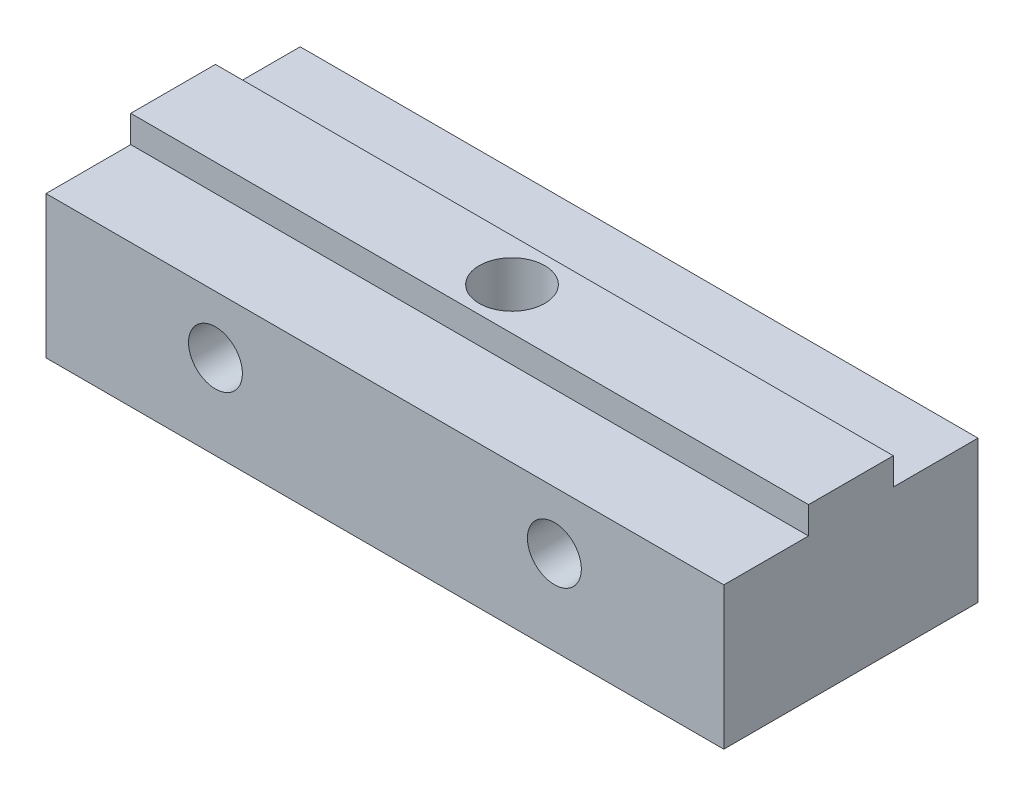
from build123d import *

# Parameters (mm, degrees)
SKETCH1_W                    = 50.8
SKETCH1_H                    = 19.05
BOSS_EXTRUDE1_DEPTH          = 12.7
F_10_32_TAPPED_HOLE1_D       = 4.0386
F_10_0_1935_DIAMETER_HOLE1_D = 4.9149
SKETCH2_OUTSIDE_W            = 63.944
SKETCH2_OUTSIDE_H            = 32.194
SKETCH2_OUTSIDE_W_2          = 50.8
SKETCH2_OUTSIDE_H_2          = 6.35
CUT_EXTRUDE1_DEPTH           = 2.032


with BuildPart() as part:
    # Sketch1 → Boss-Extrude1 (new body)
    with BuildSketch(Plane(origin=(0, 0, 0), x_dir=(1, 0, 0), z_dir=(0, 1, 0))):
        Rectangle(SKETCH1_W, SKETCH1_H)
    extrude(amount=BOSS_EXTRUDE1_DEPTH)

    # #10-32 Tapped Hole1 (through all)
    with Locations(Plane(origin=(0, 0, -9.525), x_dir=(-1, 0, 0), z_dir=(0, 0, -1))):
        with Locations((12.7, 6.35), (-12.7, 6.35)):
            Hole(F_10_32_TAPPED_HOLE1_D / 2)

    # #10 (0.1935) Diameter Hole1 (through all)
    with Locations(Plane(origin=(0, 0, 0), x_dir=(-1, 0, 0), z_dir=(0, -1, 0))):
        with Locations((0, 0)):
            Hole(F_10_0_1935_DIAMETER_HOLE1_D / 2)

    # Sketch2 outside → Cut-Extrude1 (cut)
    with BuildSketch(Plane(origin=(0, 12.7, 0), x_dir=(1, 0, 0), z_dir=(0, 1, 0))):
        Rectangle(SKETCH2_OUTSIDE_W, SKETCH2_OUTSIDE_H)
        Rectangle(SKETCH2_OUTSIDE_W_2, SKETCH2_OUTSIDE_H_2, mode=Mode.SUBTRACT)
    extrude(amount=-CUT_EXTRUDE1_DEPTH, mode=Mode.SUBTRACT)


solid = part.part
